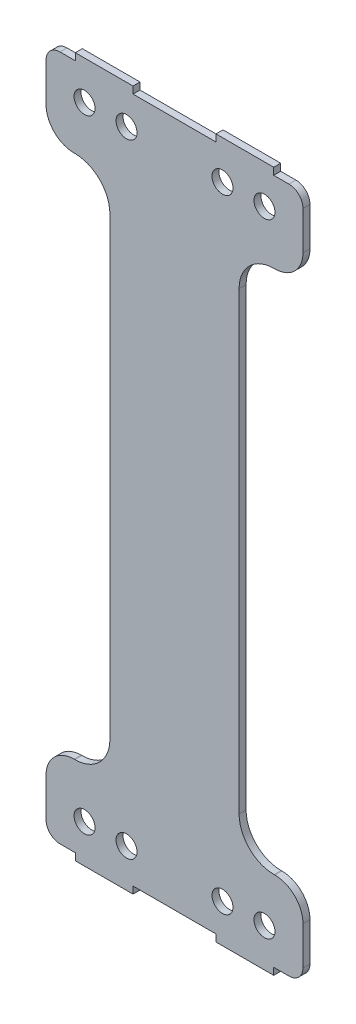
from build123d import *

# Parameters (mm, degrees)
BOSS_EXTRUDE2_DEPTH = 1
SKETCH2_R           = 1.5
SKETCH2_R_2         = 1.499999993
CUT_EXTRUDE8_DEPTH  = 3
FILLET2_R           = 4
FILLET3_R           = 5
FILLET4_R           = 4
FILLET5_R           = 5
FILLET6_R           = 2
FILLET7_R           = 2
FILLET8_R           = 2
FILLET9_R           = 2
FILLET12_R          = 4
FILLET13_R          = 5


with BuildPart() as part:
    # Sketch1 → Boss-Extrude2 (new body)
    with BuildSketch(Plane.XY):
        Polygon((0, 0), (4.18, 0), (4.18, 1), (12.43, 1), (12.43, 0), (24.28, 0), (24.28, 1), (32.53, 1), (32.53, 0), (36.71, 0), (36.71, -11.5), (27.585, -11.5), (27.585, -86.5), (36.71, -86.5), (36.71, -98), (32.53, -98), (32.53, -99), (24.28, -99), (24.28, -98), (12.43, -98), (12.43, -99), (4.18, -99), (4.18, -98), (0, -98), (0, -86.5), (9.125, -86.5), (9.125, -11.5), (0, -11.5), align=None)
    extrude(amount=BOSS_EXTRUDE2_DEPTH)

    # Sketch2 → Cut-Extrude8 (cut)
    with BuildSketch(Plane.XY):
        with Locations((5.5, -4.499987612)):
            Circle(SKETCH2_R)
        with Locations((11.5, -4.499987612)):
            Circle(SKETCH2_R)
        with Locations((25.21, -4.5)):
            Circle(SKETCH2_R)
        with Locations((31.21, -4.5)):
            Circle(SKETCH2_R_2)
        with Locations((5.5, -93.500004994)):
            Circle(SKETCH2_R)
        with Locations((11.5, -93.500004994)):
            Circle(SKETCH2_R)
        with Locations((25.21, -93.5)):
            Circle(SKETCH2_R)
        with Locations((31.21, -93.5)):
            Circle(SKETCH2_R)
    extrude(amount=CUT_EXTRUDE8_DEPTH, mode=Mode.SUBTRACT)

    # Fillet2
    fillet2_edges = [part.edges().sort_by_distance(p)[0] for p in [
        (36.71, -86.5, 0.5),
    ]]
    fillet(fillet2_edges, radius=FILLET2_R)

    # Fillet3
    fillet3_edges = [part.edges().sort_by_distance(p)[0] for p in [
        (27.585, -86.5, 0.5),
    ]]
    fillet(fillet3_edges, radius=FILLET3_R)

    # Fillet4
    fillet4_edges = [part.edges().sort_by_distance(p)[0] for p in [
        (0, -86.5, 0.5),
    ]]
    fillet(fillet4_edges, radius=FILLET4_R)

    # Fillet5
    fillet5_edges = [part.edges().sort_by_distance(p)[0] for p in [
        (9.125, -86.5, 0.5),
    ]]
    fillet(fillet5_edges, radius=FILLET5_R)

    # Fillet6
    fillet6_edges = [part.edges().sort_by_distance(p)[0] for p in [
        (0, -98, 0.5),
    ]]
    fillet(fillet6_edges, radius=FILLET6_R)

    # Fillet7
    fillet7_edges = [part.edges().sort_by_distance(p)[0] for p in [
        (36.71, -98, 0.5),
    ]]
    fillet(fillet7_edges, radius=FILLET7_R)

    # Fillet8
    fillet8_edges = [part.edges().sort_by_distance(p)[0] for p in [
        (0, 0, 0.5),
    ]]
    fillet(fillet8_edges, radius=FILLET8_R)

    # Fillet9
    fillet9_edges = [part.edges().sort_by_distance(p)[0] for p in [
        (36.71, 0, 0.5),
    ]]
    fillet(fillet9_edges, radius=FILLET9_R)

    # Fillet12
    fillet12_edges = [part.edges().sort_by_distance(p)[0] for p in [
        (36.71, -11.5, 0.5),
        (0, -11.5, 0.5),
    ]]
    fillet(fillet12_edges, radius=FILLET12_R)

    # Fillet13
    fillet13_edges = [part.edges().sort_by_distance(p)[0] for p in [
        (27.585, -11.5, 0.5),
        (9.125, -11.5, 0.5),
    ]]
    fillet(fillet13_edges, radius=FILLET13_R)


solid = part.part
